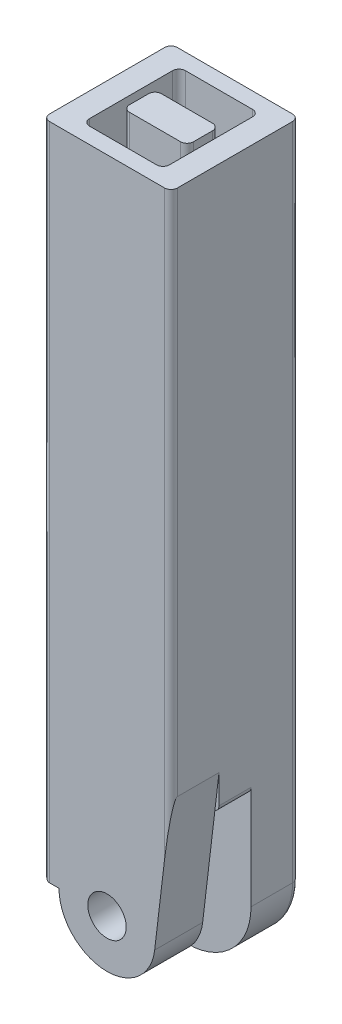
from build123d import *

# Parameters (mm, degrees)
BOSS_EXTRUDE1_DEPTH             = 7.5
BOSS_EXTRUDE2_DEPTH             = 5
BOSS_EXTRUDE3_DEPTH             = 7.5
SKETCH4_R                       = 3
CUT_EXTRUDE1_DEPTH              = 106.399240984
CUT_EXTRUDE2_DEPTH              = 14.1
FILLET1_R                       = 1
M3X0_5_TAPPED_HOLE1_D           = 2.5
M3X0_5_TAPPED_HOLE1_DEPTH       = 18
M3X0_5_TAPPED_HOLE1_CSINK_D     = 5.6
M3X0_5_TAPPED_HOLE1_CSINK_ANGLE = 90
M3X0_5_TAPPED_HOLE1_TIP         = 0.751075774


with BuildPart() as part:
    # Sketch1 → Boss-Extrude1 (new body)
    with BuildSketch(Plane.XY):
        with BuildLine():
            Line((0, -10), (0, -5))
            ThreePointArc((0, -5), (-2.886751346, -4.082482905), (-4.714045208, -1.666666667))
            ThreePointArc((-4.714045208, -1.666666667), (-5.627692139, -0.458758548), (-7.071067812, 0))
            Line((-7.071067812, 0), (-7.5, 0))
            ThreePointArc((-7.5, 0), (-9.267766953, 0.732233047), (-10, 2.5))
            Line((-10, 2.5), (-10, 103))
            Line((-10, 103), (10, 103))
            Line((10, 103), (10, 0))
            ThreePointArc((10, 0), (7.071067812, -7.071067812), (0, -10))
        make_face()
    extrude(amount=BOSS_EXTRUDE1_DEPTH)

    # Sketch2 → Boss-Extrude2 (add)
    with BuildSketch(Plane.XY.offset(7.5)):
        with BuildLine():
            Line((-10, 103), (10, 103))
            Line((10, 103), (10, 14.361406616))
            ThreePointArc((10, 14.361406616), (0, 17.5), (-10, 14.361406616))
            Line((-10, 14.361406616), (-10, 103))
        make_face()
    extrude(amount=BOSS_EXTRUDE2_DEPTH)

    # Sketch3 → Boss-Extrude3 (add)
    with BuildSketch(Plane.XY.offset(12.5)):
        with BuildLine():
            Line((7.447916037, -0.882352941), (10, 20.659715081))
            Line((10, 20.659715081), (10, 103))
            Line((10, 103), (-10, 103))
            Line((-10, 103), (-10, 0))
            Line((-10, 0), (-7.5, 0))
            ThreePointArc((-7.5, 0), (-0.441944412, -7.486967686), (7.447916037, -0.882352941))
        make_face()
    extrude(amount=BOSS_EXTRUDE3_DEPTH)

    # Sketch4 → Cut-Extrude1 (cut, through all)
    with BuildSketch(Plane(origin=(0, 0, 0), x_dir=(-1, 0, 0), z_dir=(0, 0, -1))):
        Circle(SKETCH4_R)
    extrude(amount=-CUT_EXTRUDE1_DEPTH, mode=Mode.SUBTRACT)

    # Sketch5 → Cut-Extrude2 (cut)
    with BuildSketch(Plane(origin=(0, 103, 0), x_dir=(1, 0, 0), z_dir=(0, 1, 0))):
        with BuildLine():
            Line((-5.25, -17.5), (5.25, -17.5))
            ThreePointArc((5.25, -17.5), (5.957106781, -17.207106781), (6.25, -16.5))
            Line((6.25, -16.5), (6.25, -3.5))
            ThreePointArc((6.25, -3.5), (5.957106781, -2.792893219), (5.25, -2.5))
            Line((5.25, -2.5), (-5.25, -2.5))
            ThreePointArc((-5.25, -2.5), (-5.957106781, -2.792893219), (-6.25, -3.5))
            Line((-6.25, -3.5), (-6.25, -16.5))
            ThreePointArc((-6.25, -16.5), (-5.957106781, -17.207106781), (-5.25, -17.5))
        make_face()
        with BuildLine():
            Line((-4, -12.5), (4, -12.5))
            ThreePointArc((4, -12.5), (4.707106781, -12.207106781), (5, -11.5))
            Line((5, -11.5), (5, -8.5))
            ThreePointArc((5, -8.5), (4.707106781, -7.792893219), (4, -7.5))
            Line((4, -7.5), (-4, -7.5))
            ThreePointArc((-4, -7.5), (-4.707106781, -7.792893219), (-5, -8.5))
            Line((-5, -8.5), (-5, -11.5))
            ThreePointArc((-5, -11.5), (-4.707106781, -12.207106781), (-4, -12.5))
        make_face(mode=Mode.SUBTRACT)
    extrude(amount=-CUT_EXTRUDE2_DEPTH, mode=Mode.SUBTRACT)

    # Fillet1
    # the kernel refuses this fillet: 1 mm, written as the material it takes off along each edge
    with BuildSketch(Plane(origin=(10, 105.5, 0), x_dir=(-1, 0, 0), z_dir=(0, -1, 0))) as fillet1_piece_1:
        with BuildLine():
            CenterArc((FILLET1_R, -FILLET1_R), FILLET1_R, 90, 90)
            Line((0, -FILLET1_R), (0, 0))
            Line((0, 0), (FILLET1_R, 0))
        make_face()
    extrude(amount=105.5, mode=Mode.SUBTRACT)
    with BuildSketch(Plane(origin=(0, 0, 0), x_dir=(1, 0, 0), z_dir=(0, 1, 0))) as fillet1_piece_2:
        with BuildLine():
            CenterArc((10 - FILLET1_R, -FILLET1_R), FILLET1_R, 0, 90)
            Line((10 - FILLET1_R, 0), (10, 0))
            Line((10, 0), (10, -FILLET1_R))
        make_face()
    revolve(axis=Axis((0, 0, 0), (0, 0, -1)), revolution_arc=104.329698924, mode=Mode.SUBTRACT)
    with BuildSketch(Plane(origin=(0, 0, 0), x_dir=(0, -1, 0), z_dir=(1, 0, 0))) as fillet1_piece_3:
        with BuildLine():
            CenterArc((5 - FILLET1_R, -FILLET1_R), FILLET1_R, 0, 90)
            Line((5 - FILLET1_R, 0), (5, 0))
            Line((5, 0), (5, -FILLET1_R))
        make_face()
    revolve(axis=Axis((0, 0, 0), (0, 0, -1)), revolution_arc=70.528779366, mode=Mode.SUBTRACT)
    with BuildSketch(Plane(origin=(-7.071067812, -2.5, 0), x_dir=(0.9428090415820636, 0.3333333333333328, 0), z_dir=(0.3333333333333328, -0.9428090415820636, 0))) as fillet1_piece_4:
        with BuildLine():
            CenterArc((2.5 + FILLET1_R, FILLET1_R), FILLET1_R, 180, 90)
            Line((2.5, FILLET1_R), (2.5, 0))
            Line((2.5, 0), (2.5 + FILLET1_R, 0))
        make_face()
    revolve(axis=Axis((-7.071067812, -2.5, 0), (0, 0, 1)), revolution_arc=70.528779366, mode=Mode.SUBTRACT)
    with BuildSketch(Plane(origin=(0, -10, -2.782087795), x_dir=(0, 1, 0), z_dir=(0, 0, 1))) as fillet1_piece_5:
        with BuildLine():
            CenterArc((1.05572809, -1), FILLET1_R, 90, 96.379370208)
            ThreePointArc((0.0619201, -1.111111111), (0.015492025, -0.556417559), (0, 0))
            Line((0, 0), (1.05572809, 0))
        make_face()
    extrude(amount=13.06417559, mode=Mode.SUBTRACT)
    with BuildSketch(Plane(origin=(10, 14.361406616, 7.5), x_dir=(0, 1, 0), z_dir=(0, 0, 1))) as fillet1_piece_6:
        with BuildLine():
            CenterArc((1.801823259, 1), FILLET1_R, 150.89009106, 119.10990894)
            ThreePointArc((0.928135158, 1.486486486), (0.482686338, 0.731618028), (0, 0))
            Line((0, 0), (1.801823259, 0))
        make_face()
    extrude(amount=5, mode=Mode.SUBTRACT)
    with BuildSketch(Plane(origin=(-10, 0, 10), x_dir=(0, 1, 0), z_dir=(0, 0, 1))) as fillet1_piece_7:
        with BuildLine():
            CenterArc((FILLET1_R, -FILLET1_R), FILLET1_R, 90, 90)
            Line((0, -FILLET1_R), (0, 0))
            Line((0, 0), (FILLET1_R, 0))
        make_face()
    extrude(amount=12.5, mode=Mode.SUBTRACT)
    with BuildSketch(Plane(origin=(10, 8.159715081, 20), x_dir=(0, 0, -1), z_dir=(0, 1, 0))) as fillet1_piece_8:
        with BuildLine():
            CenterArc((FILLET1_R, FILLET1_R), FILLET1_R, 180, 90)
            Line((0, FILLET1_R), (0, 0))
            Line((0, 0), (FILLET1_R, 0))
        make_face()
    extrude(amount=97.340284919, mode=Mode.SUBTRACT)
    with BuildSketch(Plane(origin=(-10, 105.5, 20), x_dir=(0, 0, -1), z_dir=(0, -1, 0))) as fillet1_piece_9:
        with BuildLine():
            CenterArc((FILLET1_R, FILLET1_R), FILLET1_R, 180, 90)
            Line((0, FILLET1_R), (0, 0))
            Line((0, 0), (FILLET1_R, 0))
        make_face()
    extrude(amount=108, mode=Mode.SUBTRACT)
    with BuildSketch(Plane(origin=(-7.071067812, 0, 0), x_dir=(0, 1, 0), z_dir=(-1, 0, 0))) as fillet1_piece_10:
        with BuildLine():
            CenterArc((FILLET1_R, -FILLET1_R), FILLET1_R, 90, 90)
            Line((0, -FILLET1_R), (0, 0))
            Line((0, 0), (FILLET1_R, 0))
        make_face()
    extrude(amount=0.428932188, mode=Mode.SUBTRACT)
    with BuildSketch(Plane(origin=(-7.5, 2.5, 0), x_dir=(0, -1, 0), z_dir=(1, 0, 0))) as fillet1_piece_11:
        with BuildLine():
            CenterArc((2.5 - FILLET1_R, -FILLET1_R), FILLET1_R, 0, 90)
            Line((2.5, -FILLET1_R), (2.5, 0))
            Line((2.5, 0), (2.5 - FILLET1_R, 0))
        make_face()
    revolve(axis=Axis((-7.5, 2.5, 0), (0, 0, -1)), revolution_arc=90, mode=Mode.SUBTRACT)
    with BuildSketch(Plane(origin=(-10, 2.5, 0), x_dir=(1, 0, 0), z_dir=(0, 1, 0))) as fillet1_piece_12:
        with BuildLine():
            CenterArc((FILLET1_R, -FILLET1_R), FILLET1_R, 90, 90)
            Line((0, -FILLET1_R), (0, 0))
            Line((0, 0), (FILLET1_R, 0))
        make_face()
    extrude(amount=103, mode=Mode.SUBTRACT)

    # M3x0.5 Tapped Hole1
    with Locations(Plane.ZY.offset(10)):
        with Locations((15, 95.95), (5, 95.95)):
            CounterSinkHole(M3X0_5_TAPPED_HOLE1_D / 2, M3X0_5_TAPPED_HOLE1_CSINK_D / 2, depth=M3X0_5_TAPPED_HOLE1_DEPTH, counter_sink_angle=M3X0_5_TAPPED_HOLE1_CSINK_ANGLE)
            with Locations((0, 0, -(M3X0_5_TAPPED_HOLE1_DEPTH + M3X0_5_TAPPED_HOLE1_TIP / 2))):  # 118° drill point
                Cone(0, M3X0_5_TAPPED_HOLE1_D / 2, M3X0_5_TAPPED_HOLE1_TIP, mode=Mode.SUBTRACT)


solid = part.part
